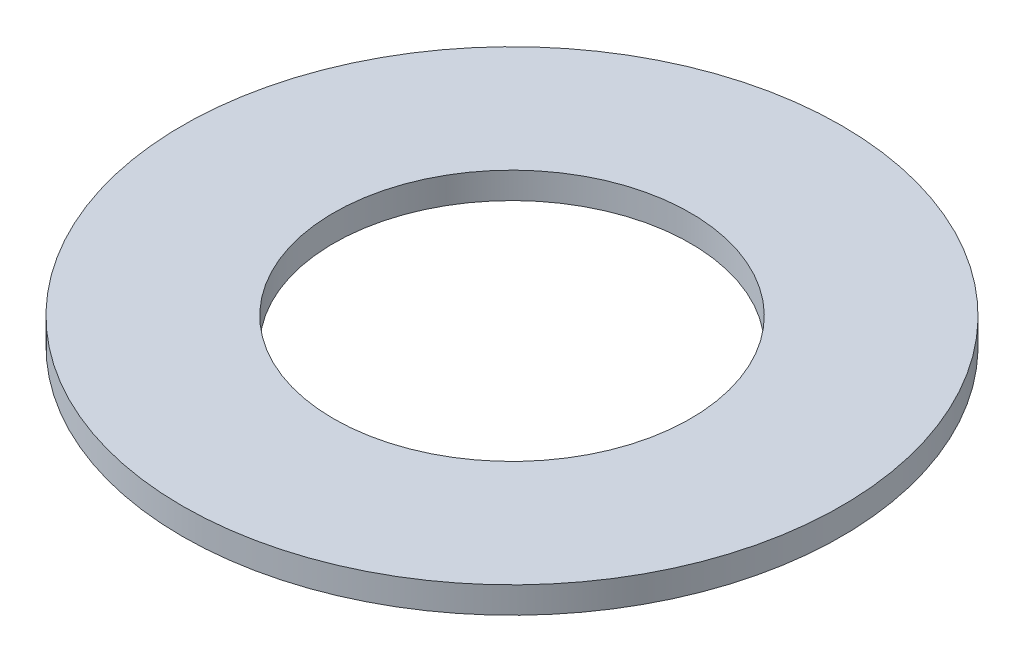
from build123d import *

# Parameters (mm, degrees)
SKETCH1_R           = 19.05
BOSS_EXTRUDE1_DEPTH = 1.524
SKETCH5_R           = 10.3124
CUT_EXTRUDE1_DEPTH  = 27.983839163


with BuildPart() as part:
    # Sketch1 → Boss-Extrude1 (new body)
    with BuildSketch(Plane(origin=(0, 0, 0), x_dir=(1, 0, 0), z_dir=(0, 1, 0))):
        Circle(SKETCH1_R)
    extrude(amount=BOSS_EXTRUDE1_DEPTH)

    # Sketch5 → Cut-Extrude1 (cut, through all)
    with BuildSketch(Plane(origin=(0, 1.524, 0), x_dir=(-1, 0, 0), z_dir=(0, 1, 0))):
        Circle(SKETCH5_R)
    extrude(amount=-CUT_EXTRUDE1_DEPTH, mode=Mode.SUBTRACT)


solid = part.part
